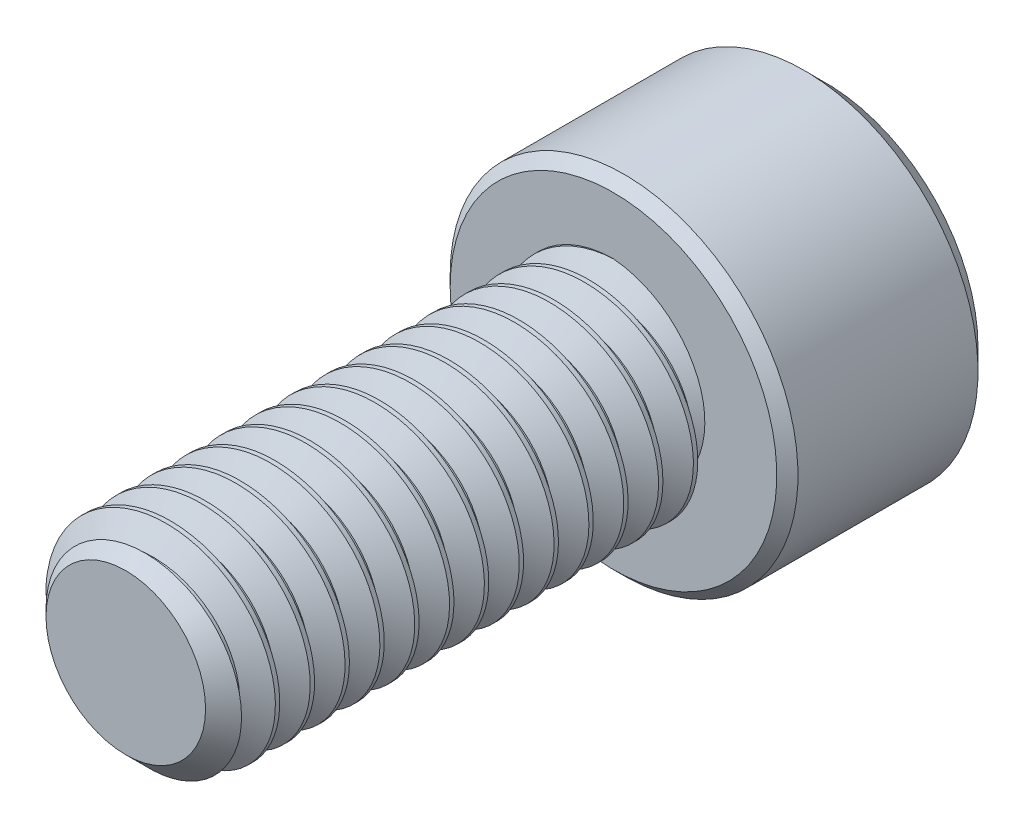
from build123d import *

# Parameters (mm, degrees)
SKETCH1_R          = 2.413
EXTRUDE1_DEPTH     = 11.1125
CHAMFER3_SIZE      = 0.5953125
CUT_SWEEP1_PITCH   = 0.79375
SKETCH6_R          = 3.9624
EXTRUDE2_DEPTH     = 4.826
CUT_EXTRUDE1_DEPTH = 2.9765625
SKETCH8_R          = 2.291358881
CUT_EXTRUDE2_DEPTH = 0.4826
CUT_EXTRUDE2_DRAFT = -45
CHAMFER1_SIZE      = 0.4826
CHAMFER2_SIZE      = 0.2413


with BuildPart() as part:
    # Sketch1 → Extrude1 (new body)
    with BuildSketch(Plane.XY):
        Circle(SKETCH1_R)
    extrude(amount=-EXTRUDE1_DEPTH)

    # Chamfer3
    chamfer3_edges = [part.edges().sort_by_distance(p)[0] for p in [
        (-2.413, 0, 0),
    ]]
    chamfer(chamfer3_edges, length=CHAMFER3_SIZE)

    # Cut-Sweep1: the profile of Sketch3 profile screwed along a right-hand helix of 15 turns, 6 arcs to a turn; built about Z, then put on its axis
    cut_sweep1_z = Axis((0, 0, 0), (0, 0, 1))
    cut_sweep1_corners = [(2.4133, 0, -0.694704455), (1.897444252, 0, -0.396875), (1.897444252, 0, -0.29765625), (2.4133, 0, 0.000173205)]
    with BuildLine(mode=Mode.PRIVATE) as cut_sweep1_profile:
        Line(cut_sweep1_corners[0], cut_sweep1_corners[1])
        Line(cut_sweep1_corners[1], cut_sweep1_corners[2])
        Line(cut_sweep1_corners[2], cut_sweep1_corners[3])
        Line(cut_sweep1_corners[3], cut_sweep1_corners[0])
    cut_sweep1_cap = Face(cut_sweep1_profile.wire())
    cut_sweep1_turn_angles = [0, 30, 60, 90, 120, 150, 180, 210, 240, 270, 300, 330, 360]
    cut_sweep1_turn_weights = [1, 0.8660254037844387, 1, 0.8660254037844387, 1, 0.8660254037844387, 1, 0.8660254037844387, 1, 0.8660254037844387, 1, 0.8660254037844387, 1]
    cut_sweep1_turn_rails = [Edge.make_bspline([Vector(p[0], p[1], 0).rotate(cut_sweep1_z, cut_sweep1_turn_angles[k]) / cut_sweep1_turn_weights[k] + Vector(0, 0, p[2] + CUT_SWEEP1_PITCH * cut_sweep1_turn_angles[k] / 360) for k in range(13)], [0, 0, 0, 1, 1, 2, 2, 3, 3, 4, 4, 5, 5, 6, 6, 6], 2, cut_sweep1_turn_weights) for p in cut_sweep1_corners]
    cut_sweep1_turn_sides = [Face.make_surface_from_curves(cut_sweep1_turn_rails[p[0]], cut_sweep1_turn_rails[p[1]]) for p in [(0, 1), (1, 2), (2, 3), (3, 0)]]
    cut_sweep1 = Plane(origin=(0, 0, 0), x_dir=(0, 1, 0), z_dir=(0, 0, -1)) * Solid(Shell([*[p.moved(Location((0, 0, CUT_SWEEP1_PITCH * i))) for i in range(15) for p in cut_sweep1_turn_sides], cut_sweep1_cap, cut_sweep1_cap.rotate(cut_sweep1_z, 5400).moved(Location((0, 0, CUT_SWEEP1_PITCH * 5400 / 360)))]))
    add(cut_sweep1, mode=Mode.SUBTRACT)

    # Sketch6 → Extrude2 (add)
    with BuildSketch(Plane(origin=(0, 0, -11.1125), x_dir=(-1, 0, 0), z_dir=(0, 0, -1))):
        Circle(SKETCH6_R)
    extrude(amount=EXTRUDE2_DEPTH)

    # Sketch7 → Cut-Extrude1 (cut)
    with BuildSketch(Plane(origin=(0, 0, -15.9385), x_dir=(-1, 0, 0), z_dir=(0, 0, -1))):
        Polygon((0, 2.291358881), (-1.984375, 1.14567944), (-1.984375, -1.14567944), (0, -2.291358881), (1.984375, -1.14567944), (1.984375, 1.14567944), align=None)
    extrude(amount=-CUT_EXTRUDE1_DEPTH, mode=Mode.SUBTRACT)


with BuildPart() as cut_extrude2_tool:
    # Sketch8 → Cut-Extrude2 (with draft: the straight prism first)
    with BuildSketch(Plane(origin=(0, 0, -15.9385), x_dir=(-1, 0, 0), z_dir=(0, 0, -1))):
        Circle(SKETCH8_R)
    extrude(amount=-CUT_EXTRUDE2_DEPTH)
    # Cut-Extrude2: the draft: its side faces are tilted about the plane it starts from
    cut_extrude2_sides = [cut_extrude2_tool.faces().sort_by_distance(p)[0] for p in [
        (2.291358881, 0, -15.6972),
    ]]
    draft(cut_extrude2_sides, Plane(origin=(0, 0, -15.9385), x_dir=(-1, 0, 0), z_dir=(0, 0, -1)), CUT_EXTRUDE2_DRAFT)


with BuildPart() as part_1:
    add(part.part)

    # Cut-Extrude2: cut by cut_extrude2_tool
    add(cut_extrude2_tool.part, mode=Mode.SUBTRACT)

    # Chamfer1
    chamfer1_edges = [part_1.edges().sort_by_distance(p)[0] for p in [
        (3.9624, 0, -15.9385),
    ]]
    chamfer(chamfer1_edges, length=CHAMFER1_SIZE)

    # Chamfer2
    chamfer2_edges = [part_1.edges().sort_by_distance(p)[0] for p in [
        (3.9624, 0, -11.1125),
    ]]
    chamfer(chamfer2_edges, length=CHAMFER2_SIZE)


solid = part_1.part
